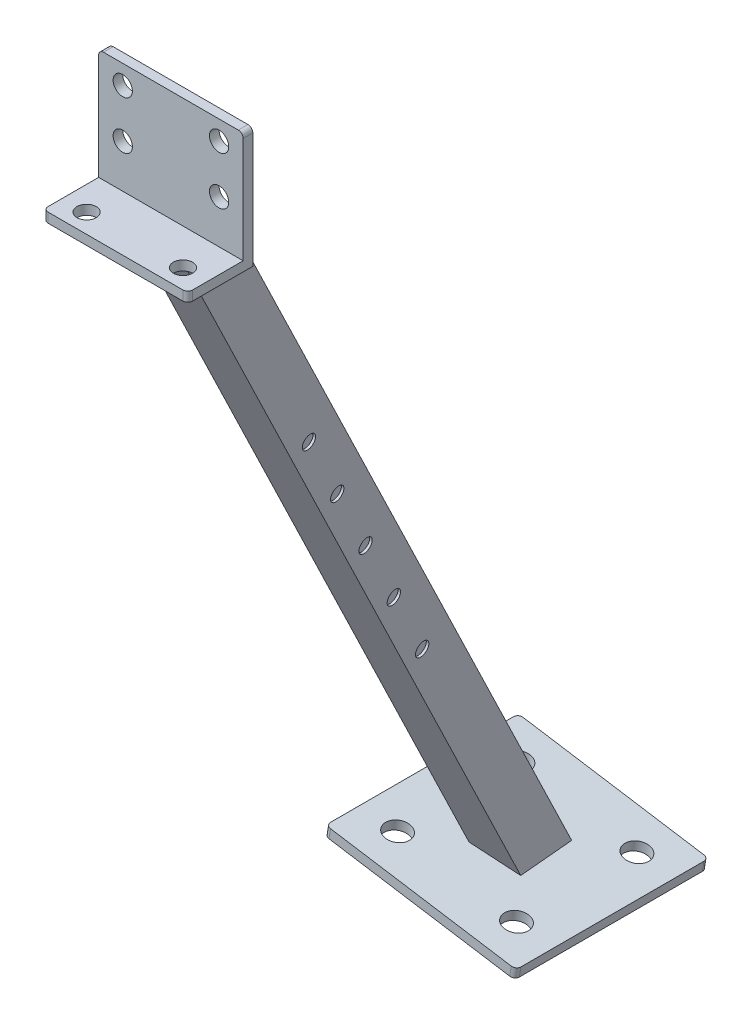
from build123d import *

# Parameters (mm, degrees)
BOSS_EXTRUDE1_DEPTH      = 60
BOSS_EXTRUDE2_DEPTH      = 500
BOSS_EXTRUDE2_DEPTH_BACK = 20
SKETCH3_W                = 20
SKETCH3_H                = 20
SKETCH3_W_2              = 18
SKETCH3_H_2              = 18
CUT_EXTRUDE1_DEPTH       = 60
SKETCH7_W                = 80
SKETCH7_H                = 80
BOSS_EXTRUDE3_DEPTH      = 4
SKETCH8_W                = 96.387466959
SKETCH8_H                = 104.058165024
CUT_EXTRUDE3_DEPTH       = 100
CUT_EXTRUDE4_REACH       = 450.752
SKETCH9_R                = 3.999999996
CUT_EXTRUDE5_REACH       = 450.752
SKETCH10_R               = 4.000000003
CUT_EXTRUDE6_REACH       = 492.61
SKETCH11_R               = 5
FILLET1_R                = 2
FILLET2_R                = 2
SKETCH12_RX              = 3
SKETCH12_RY              = 2.990164225
CUT_EXTRUDE7_DEPTH       = 450.440488821


with BuildPart() as part:
    # Sketch1 → Boss-Extrude1 (new body)
    with BuildSketch(Plane(origin=(0, 0, 0), x_dir=(0, 0, -1), z_dir=(1, 0, 0))):
        Polygon((0, 0), (0, 50), (-4, 50), (-4, 4), (-27, 4), (-27, 0), align=None)
    extrude(amount=BOSS_EXTRUDE1_DEPTH)

    # Sketch3 → Boss-Extrude2 (add, two sides: drawn at the far end of the back side and taken through both)
    with BuildSketch(Plane(origin=(0.734152256, 4.01424851, 2.317627458), x_dir=(0, -0.49999999999998884, 0.866025403784445), z_dir=(-0.1564344650402179, -0.8553631939770945, -0.4938441702975589)).offset(-BOSS_EXTRUDE2_DEPTH_BACK)):
        with Locations((0, -29.630650218)):
            Rectangle(SKETCH3_W, SKETCH3_H)
        with Locations((0, -29.630650218)):
            Rectangle(SKETCH3_W_2, SKETCH3_H_2, mode=Mode.SUBTRACT)
    extrude(amount=BOSS_EXTRUDE2_DEPTH + BOSS_EXTRUDE2_DEPTH_BACK)

    # Sketch5 → Cut-Extrude1 (cut)
    with BuildSketch(Plane.ZY):
        Polygon((4, 4), (4, 36.054903459), (38.781358344, 4), align=None)
    extrude(amount=-CUT_EXTRUDE1_DEPTH, mode=Mode.SUBTRACT)

    # Sketch7 → Boss-Extrude3 (add)
    with BuildSketch(Plane(origin=(-56.75697757, -358.349448921, -6.04e-07), x_dir=(0.9876883403131397, -0.15643446682069614, -2.6345369953248584e-10), z_dir=(0.15643446682069614, 0.9876883403131398, 1.6633811750632153e-09))):
        with Locations((20.602499468, 205.593738915)):
            Rectangle(SKETCH7_W, SKETCH7_H)
    extrude(amount=BOSS_EXTRUDE3_DEPTH)

    # Sketch8 → Cut-Extrude3 (cut)
    with BuildSketch(Plane(origin=(-56.75697757, -358.349448921, -6.04e-07), x_dir=(0.9876883403131398, -0.15643446682069642, -2.6345368640035017e-10), z_dir=(-0.15643446682069642, -0.9876883403131398, -1.6633810921501747e-09))):
        with Locations((22.720042887, -232.311236701)):
            Rectangle(SKETCH8_W, SKETCH8_H)
    extrude(amount=CUT_EXTRUDE3_DEPTH, mode=Mode.SUBTRACT)

    # Sketch9 → Cut-Extrude4 (cut, up to next)
    with BuildSketch(Plane(origin=(0, 0, 0), x_dir=(-1, 0, 0), z_dir=(0, 0, -1)), mode=Mode.PRIVATE) as cut_extrude4_sk1:
        with Locations((-50, 22)):
            Circle(SKETCH9_R)
    cut_extrude4_tool1 = extrude(cut_extrude4_sk1.sketch, amount=-CUT_EXTRUDE4_REACH, mode=Mode.PRIVATE) & part.part
    # Sketch9 → Cut-Extrude4 (cut, up to next)
    with BuildSketch(Plane(origin=(0, 0, 0), x_dir=(-1, 0, 0), z_dir=(0, 0, -1)), mode=Mode.PRIVATE) as cut_extrude4_sk2:
        with Locations((-10, 22)):
            Circle(SKETCH9_R)
    cut_extrude4_tool2 = extrude(cut_extrude4_sk2.sketch, amount=-CUT_EXTRUDE4_REACH, mode=Mode.PRIVATE) & part.part
    # Sketch9 → Cut-Extrude4 (cut, up to next)
    with BuildSketch(Plane(origin=(0, 0, 0), x_dir=(-1, 0, 0), z_dir=(0, 0, -1)), mode=Mode.PRIVATE) as cut_extrude4_sk3:
        with Locations((-10, 42)):
            Circle(SKETCH9_R)
    cut_extrude4_tool3 = extrude(cut_extrude4_sk3.sketch, amount=-CUT_EXTRUDE4_REACH, mode=Mode.PRIVATE) & part.part
    # Sketch9 → Cut-Extrude4 (cut, up to next)
    with BuildSketch(Plane(origin=(0, 0, 0), x_dir=(-1, 0, 0), z_dir=(0, 0, -1)), mode=Mode.PRIVATE) as cut_extrude4_sk4:
        with Locations((-50, 42)):
            Circle(SKETCH9_R)
    cut_extrude4_tool4 = extrude(cut_extrude4_sk4.sketch, amount=-CUT_EXTRUDE4_REACH, mode=Mode.PRIVATE) & part.part
    add(cut_extrude4_tool1.solids().sort_by_distance((50, 22, 0))[0], mode=Mode.SUBTRACT)
    add(cut_extrude4_tool2.solids().sort_by_distance((10, 22, 0))[0], mode=Mode.SUBTRACT)
    add(cut_extrude4_tool3.solids().sort_by_distance((10, 42, 0))[0], mode=Mode.SUBTRACT)
    add(cut_extrude4_tool4.solids().sort_by_distance((50, 42, 0))[0], mode=Mode.SUBTRACT)

    # Sketch10 → Cut-Extrude5 (cut, up to next)
    with BuildSketch(Plane.XZ, mode=Mode.PRIVATE) as cut_extrude5_sk1:
        with Locations(Location((50, 19, 0), (0, 0, 270))):
            Circle(SKETCH10_R)
    cut_extrude5_tool1 = extrude(cut_extrude5_sk1.sketch, amount=-CUT_EXTRUDE5_REACH, mode=Mode.PRIVATE) & part.part
    # Sketch10 → Cut-Extrude5 (cut, up to next)
    with BuildSketch(Plane.XZ, mode=Mode.PRIVATE) as cut_extrude5_sk2:
        with Locations(Location((10, 19, 0), (0, 0, 270))):
            Circle(SKETCH10_R)
    cut_extrude5_tool2 = extrude(cut_extrude5_sk2.sketch, amount=-CUT_EXTRUDE5_REACH, mode=Mode.PRIVATE) & part.part
    add(cut_extrude5_tool1.solids().sort_by_distance((50, 0, 19))[0], mode=Mode.SUBTRACT)
    add(cut_extrude5_tool2.solids().sort_by_distance((10, 0, 19))[0], mode=Mode.SUBTRACT)

    # Sketch11 → Cut-Extrude6 (cut, up to next)
    with BuildSketch(Plane(origin=(-56.75697757, -358.349448921, -6.04e-07), x_dir=(0.9876883403131398, -0.15643446682069645, -2.634536864003504e-10), z_dir=(-0.15643446682069645, -0.9876883403131398, -1.6633810921501756e-09)), mode=Mode.PRIVATE) as cut_extrude6_sk1:
        with Locations((-4.397500532, -180.593738915)):
            Circle(SKETCH11_R)
    cut_extrude6_tool1 = extrude(cut_extrude6_sk1.sketch, amount=-CUT_EXTRUDE6_REACH, mode=Mode.PRIVATE) & part.part
    # Sketch11 → Cut-Extrude6 (cut, up to next)
    with BuildSketch(Plane(origin=(-56.75697757, -358.349448921, -6.04e-07), x_dir=(0.9876883403131398, -0.15643446682069645, -2.634536864003504e-10), z_dir=(-0.15643446682069645, -0.9876883403131398, -1.6633810921501756e-09)), mode=Mode.PRIVATE) as cut_extrude6_sk2:
        with Locations((45.602499468, -180.593738915)):
            Circle(SKETCH11_R)
    cut_extrude6_tool2 = extrude(cut_extrude6_sk2.sketch, amount=-CUT_EXTRUDE6_REACH, mode=Mode.PRIVATE) & part.part
    # Sketch11 → Cut-Extrude6 (cut, up to next)
    with BuildSketch(Plane(origin=(-56.75697757, -358.349448921, -6.04e-07), x_dir=(0.9876883403131398, -0.15643446682069645, -2.634536864003504e-10), z_dir=(-0.15643446682069645, -0.9876883403131398, -1.6633810921501756e-09)), mode=Mode.PRIVATE) as cut_extrude6_sk3:
        with Locations((45.602499468, -230.593738915)):
            Circle(SKETCH11_R)
    cut_extrude6_tool3 = extrude(cut_extrude6_sk3.sketch, amount=-CUT_EXTRUDE6_REACH, mode=Mode.PRIVATE) & part.part
    # Sketch11 → Cut-Extrude6 (cut, up to next)
    with BuildSketch(Plane(origin=(-56.75697757, -358.349448921, -6.04e-07), x_dir=(0.9876883403131398, -0.15643446682069645, -2.634536864003504e-10), z_dir=(-0.15643446682069645, -0.9876883403131398, -1.6633810921501756e-09)), mode=Mode.PRIVATE) as cut_extrude6_sk4:
        with Locations((-4.397500532, -230.593738915)):
            Circle(SKETCH11_R)
    cut_extrude6_tool4 = extrude(cut_extrude6_sk4.sketch, amount=-CUT_EXTRUDE6_REACH, mode=Mode.PRIVATE) & part.part
    add(cut_extrude6_tool1.solids().sort_by_distance((-61.100338, -357.661528, -180.59374))[0], mode=Mode.SUBTRACT)
    add(cut_extrude6_tool2.solids().sort_by_distance((-11.715921, -365.483251, -180.59374))[0], mode=Mode.SUBTRACT)
    add(cut_extrude6_tool3.solids().sort_by_distance((-11.715921, -365.483251, -230.59374))[0], mode=Mode.SUBTRACT)
    add(cut_extrude6_tool4.solids().sort_by_distance((-61.100338, -357.661528, -230.59374))[0], mode=Mode.SUBTRACT)

    # Fillet1
    fillet1_edges = [part.edges().sort_by_distance(p)[0] for p in [
        (60, 50, 2),
        (60, 2, 27),
        (0, 2, 27),
        (0, 50, 2),
    ]]
    fillet(fillet1_edges, radius=FILLET1_R)

    # Fillet2
    # the kernel refuses this fillet: 2 mm, written as the material it takes off along each edge
    with BuildSketch(Plane(origin=(-76.697835011, -360.253452555, -245.593739522), x_dir=(2.0026115353614065e-15, -1.6841157483071222e-09, 1.0), z_dir=(0.15643446682069614, 0.9876883403131398, 1.6633811750632153e-09)), Plane(origin=(-76.697835011, -360.25345269, -165.593739522), x_dir=(0.9876883403131398, -0.15643446682069614, -2.634550355651499e-10), z_dir=(0.15643446682069614, 0.9876883403131398, 1.6633811750632153e-09))) as fillet2_piece_1:
        with BuildLine():
            CenterArc((FILLET2_R, FILLET2_R), FILLET2_R, 180, 90)
            Line((0, FILLET2_R), (0, 0))
            Line((0, 0), (FILLET2_R, 0))
        make_face()
    extrude(amount=14, mode=Mode.SUBTRACT)
    with BuildSketch(Plane(origin=(2.317232214, -372.768210036, -165.593739543), x_dir=(-0.9876883403131398, 0.15643446682069614, 2.634550355651978e-10), z_dir=(0.15643446682069614, 0.9876883403131398, 1.6633811750632153e-09)), Plane(origin=(2.317232214, -372.768209901, -245.593739543), x_dir=(3.518887041216593e-15, -1.6841159884615724e-09, 1.0), z_dir=(0.15643446682069614, 0.9876883403131398, 1.6633811750632153e-09))) as fillet2_piece_2:
        with BuildLine():
            CenterArc((FILLET2_R, -FILLET2_R), FILLET2_R, 90, 90)
            Line((0, -FILLET2_R), (0, 0))
            Line((0, 0), (FILLET2_R, 0))
        make_face()
    extrude(amount=14, mode=Mode.SUBTRACT)

    # Sketch12 → Cut-Extrude7 (cut, through all)
    with BuildSketch(Plane(origin=(19.388964338, -2.659486302, -1.535455133), x_dir=(0.07749165674017042, -0.01062913913579635, 0.9969363392598826), z_dir=(-0.9876883405951398, 0.13547622075225838, 0.0782172325201072))):
        with Locations(Location((-61.225870001, -111.995471629), (0, 0, 75.129892126))):
            Ellipse(SKETCH12_RX, SKETCH12_RY)
        with Locations(Location((-78.507188468, -142.423004822), (0, 0, 75.129892126))):
            Ellipse(SKETCH12_RX, SKETCH12_RY)
        with Locations(Location((-95.788506935, -172.850538016), (0, 0, 75.129892126))):
            Ellipse(SKETCH12_RX, SKETCH12_RY)
        with Locations(Location((-113.069825401, -203.278071209), (0, 0, 75.129892126))):
            Ellipse(SKETCH12_RX, SKETCH12_RY)
        with Locations(Location((-130.351143868, -233.705604403), (0, 0, 75.129892126))):
            Ellipse(SKETCH12_RX, SKETCH12_RY)
    extrude(amount=-CUT_EXTRUDE7_DEPTH, mode=Mode.SUBTRACT)


solid = part.part
